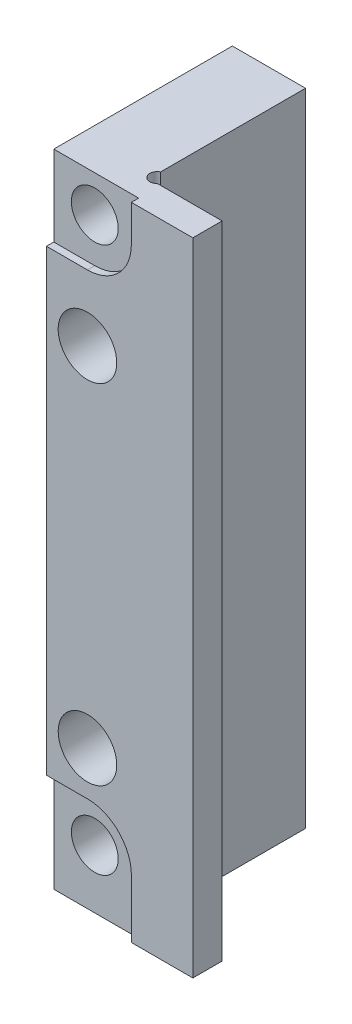
from build123d import *
from build123d.topology import SkipClean

# Parameters (mm, degrees)
SKETCH_1_W          = 10
SKETCH_1_H          = 43.8
EXTRUDE_1_DEPTH     = 10
CUT_EXTRUDE_1_DEPTH = 57.889805765
SKETCH_3_R          = 1.6
CUT_EXTRUDE_2_DEPTH = 43.398349024
SKETCH_4_R          = 2
CUT_EXTRUDE_3_DEPTH = 43.398349024
CUT_EXTRUDE_4_DEPTH = 0.5
SKETCH_6_W          = 5
SKETCH_6_H          = 43.8
SKETCH_6_R          = 2
SKETCH_6_R_2        = 1.6
EXTRUDE_2_DEPTH     = 2.7


with BuildPart() as part:
    # 草圖1 → 填料-伸長1 (new body)
    with BuildSketch(Plane.XY):
        with Locations((-29.9, 0)):
            Rectangle(SKETCH_1_W, SKETCH_1_H)
    extrude(amount=-EXTRUDE_1_DEPTH)

    # 草圖2 → 除料-伸長1 (cut, through all)
    with BuildSketch(Plane.XZ.offset(21.9)):
        with BuildLine():
            Line((-29.9, -10), (-24.9, -10))
            Line((-24.9, -10), (-24.9, -2))
            Line((-24.9, -2), (-29.322674139, -2))
            ThreePointArc((-29.322674139, -2), (-30.088835728, -2.052191426), (-29.9, -2.796549266))
            Line((-29.9, -2.796549266), (-29.9, -10))
        make_face()
    extrude(amount=-CUT_EXTRUDE_1_DEPTH, mode=Mode.SUBTRACT)

    # 草圖3 → 除料-伸長2 (cut, through all)
    with BuildSketch(Plane.XY):
        with Locations((-32.1, -17.9)):
            Circle(SKETCH_3_R)
        with Locations((-32.1, 19.4)):
            Circle(SKETCH_3_R)
    extrude(amount=-CUT_EXTRUDE_2_DEPTH, mode=Mode.SUBTRACT)

    # 草圖4 → 除料-伸長3 (cut, through all)
    with BuildSketch(Plane.XY):
        with Locations((-32.1, 11.9)):
            Circle(SKETCH_4_R)
        with Locations((-32.1, -11.9)):
            Circle(SKETCH_4_R)
    extrude(amount=-CUT_EXTRUDE_3_DEPTH, mode=Mode.SUBTRACT)

    # 草圖5 → 除料-伸長4 (cut)
    with BuildSketch(Plane.XY):
        with BuildLine():
            Line((-29.1, 19.4), (-29.1, 21.9))
            Line((-29.1, 21.9), (-34.9, 21.9))
            Line((-34.9, 21.9), (-34.9, 16.4))
            Line((-34.9, 16.4), (-32.1, 16.4))
            ThreePointArc((-32.1, 16.4), (-29.978679656, 17.278679656), (-29.1, 19.4))
        make_face()
        with BuildLine():
            Line((-32.1, -14.9), (-34.9, -14.9))
            Line((-34.9, -14.9), (-34.9, -21.9))
            Line((-34.9, -21.9), (-29.1, -21.9))
            Line((-29.1, -21.9), (-29.1, -17.9))
            ThreePointArc((-29.1, -17.9), (-29.978679656, -15.778679656), (-32.1, -14.9))
        make_face()
    extrude(amount=-CUT_EXTRUDE_4_DEPTH, mode=Mode.SUBTRACT)

    # 草圖6 → 填料-伸長2 (add)
    with SkipClean():  # the faces are left unmerged after this step: merging them gives an invalid solid
        with BuildSketch(Plane(origin=(0, 0, -10), x_dir=(-1, 0, 0), z_dir=(0, 0, -1))):
            with Locations((32.4, 0)):
                Rectangle(SKETCH_6_W, SKETCH_6_H)
            with Locations((32.1, 11.9)):
                Circle(SKETCH_6_R, mode=Mode.SUBTRACT)
            with Locations((32.1, -11.9)):
                Circle(SKETCH_6_R, mode=Mode.SUBTRACT)
            with Locations((32.1, -17.9)):
                Circle(SKETCH_6_R_2, mode=Mode.SUBTRACT)
            with Locations((32.1, 19.4)):
                Circle(SKETCH_6_R_2, mode=Mode.SUBTRACT)
        extrude(amount=EXTRUDE_2_DEPTH)


solid = part.part
